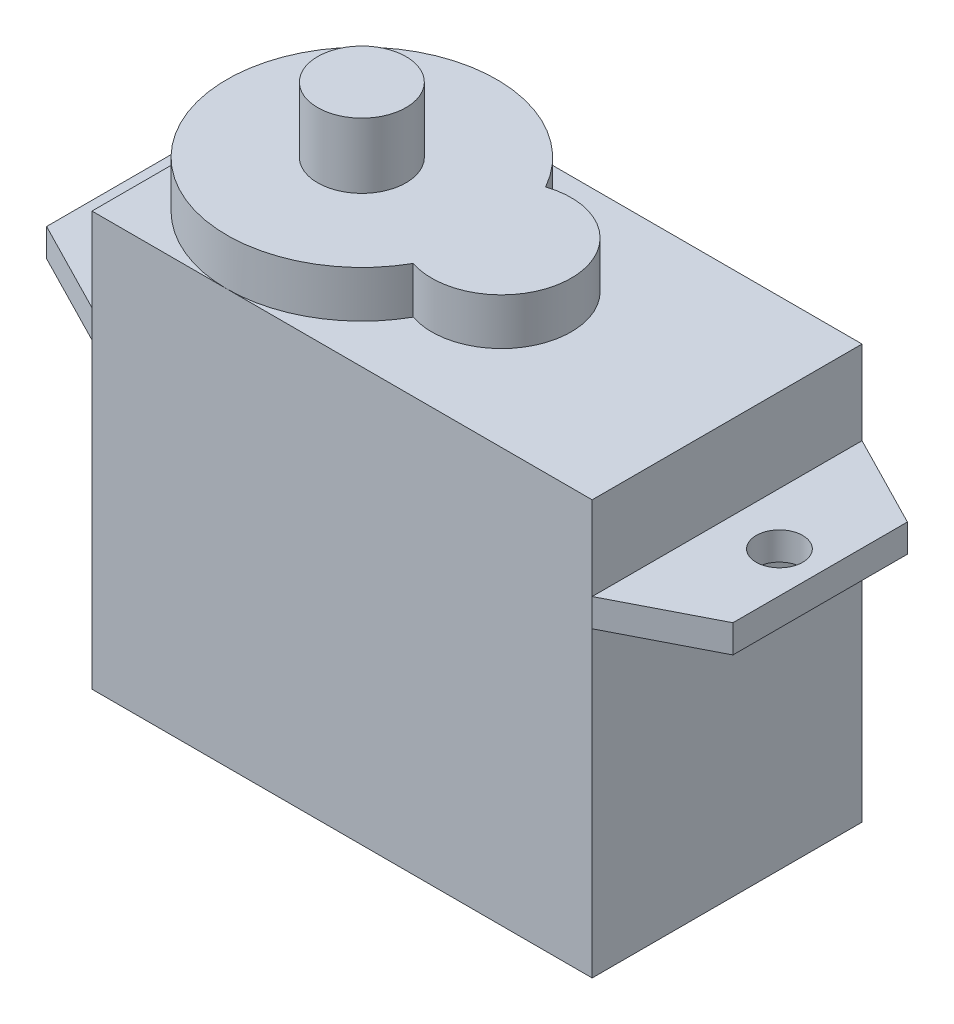
from build123d import *

# Parameters (mm, degrees)
SKETCH1_W           = 21.5
SKETCH1_H           = 11.6
BOSS_EXTRUDE1_DEPTH = 13
SKETCH2_R           = 1
BOSS_EXTRUDE2_DEPTH = 1.2
SKETCH3_W           = 21.5
SKETCH3_H           = 11.6
BOSS_EXTRUDE3_DEPTH = 3.6
BOSS_EXTRUDE4_DEPTH = 2
SKETCH5_R           = 1.9
BOSS_EXTRUDE5_DEPTH = 2.8


with BuildPart() as part:
    # Sketch1 → Boss-Extrude1 (new body)
    with BuildSketch(Plane(origin=(0, 0, 0), x_dir=(1, 0, 0), z_dir=(0, 1, 0))):
        Rectangle(SKETCH1_W, SKETCH1_H)
    extrude(amount=BOSS_EXTRUDE1_DEPTH)

    # Sketch2 → Boss-Extrude2 (add)
    with BuildSketch(Plane(origin=(0, 13, 0), x_dir=(1, 0, 0), z_dir=(0, 1, 0))):
        Polygon((-10.75, 5.8), (-14.75, 3.75), (-14.75, -3.75), (-10.75, -5.8), (10.75, -5.8), (14.75, -3.75), (14.75, 3.75), (10.75, 5.8), align=None)
        with Locations((-13, 0)):
            Circle(SKETCH2_R, mode=Mode.SUBTRACT)
        with Locations((13, 0)):
            Circle(SKETCH2_R, mode=Mode.SUBTRACT)
    extrude(amount=BOSS_EXTRUDE2_DEPTH)

    # Sketch3 → Boss-Extrude3 (add)
    with BuildSketch(Plane(origin=(0, 14.2, 0), x_dir=(1, 0, 0), z_dir=(0, 1, 0))):
        Rectangle(SKETCH3_W, SKETCH3_H)
    extrude(amount=BOSS_EXTRUDE3_DEPTH)

    # Sketch4 → Boss-Extrude4 (add)
    with BuildSketch(Plane(origin=(0, 17.8, 0), x_dir=(1, 0, 0), z_dir=(0, 1, 0))):
        with BuildLine():
            ThreePointArc((0.103333333, 2.846721311), (-10.75, 0), (0.103333333, -2.846721311))
            ThreePointArc((0.103333333, -2.846721311), (4.05, 0), (0.103333333, 2.846721311))
        make_face()
    extrude(amount=BOSS_EXTRUDE4_DEPTH)

    # Sketch5 → Boss-Extrude5 (add)
    with BuildSketch(Plane(origin=(0, 19.8, 0), x_dir=(1, 0, 0), z_dir=(0, 1, 0))):
        with Locations((-4.95, 0)):
            Circle(SKETCH5_R)
    extrude(amount=BOSS_EXTRUDE5_DEPTH)


solid = part.part
